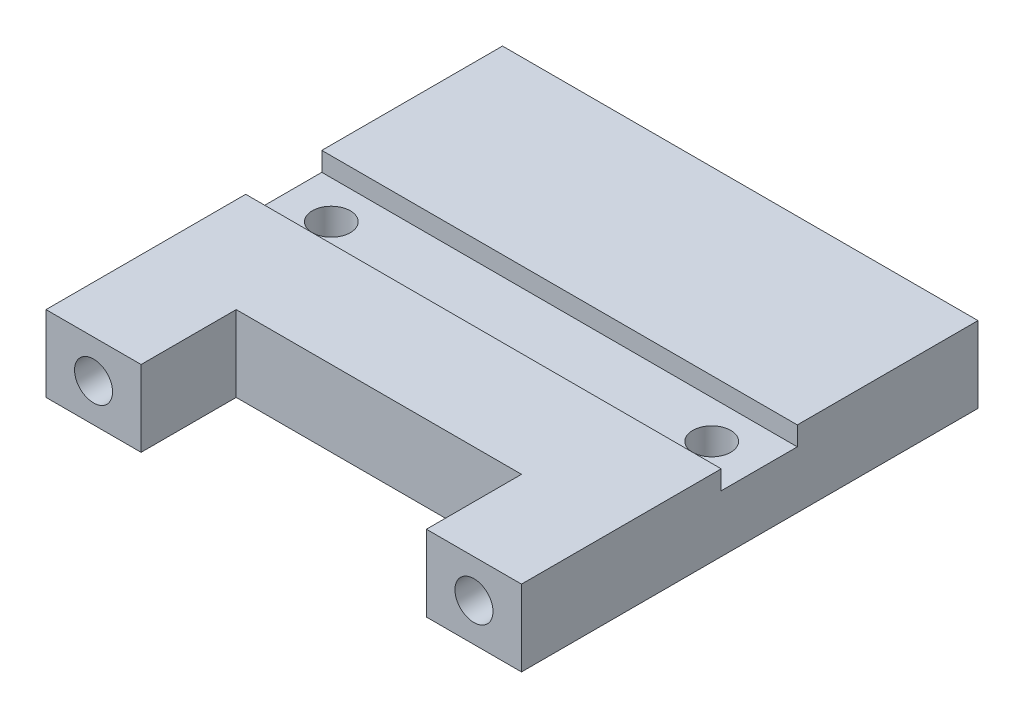
from build123d import *

# Parameters (mm, degrees)
BOSS_EXTRU_1_DEPTH      = 8
ESQUISSE2_R             = 2
ENL_V_MAT_EXTRU_1_DEPTH = 10
ENL_V_START             = -10
ESQUISSE3_R             = 2
ENL_V_MAT_EXTRU_2_DEPTH = 10
ESQUISSE4_R             = 2
ENL_V_MAT_EXTRU_3_DEPTH = 10
CHANFREIN1_SIZE         = 2.5
ESQUISSE5_W             = 50
ESQUISSE5_H             = 8
ENL_V_MAT_EXTRU_4_DEPTH = 2


with BuildPart() as part:
    # Esquisse1 → Boss.-Extru.1 (new body)
    with BuildSketch(Plane(origin=(0, 0, 0), x_dir=(1, 0, 0), z_dir=(0, 1, 0))):
        Polygon((-47.148145082, -1.958333333), (-47.148145082, 8.041666667), (-17.148145082, 8.041666667), (-17.148145082, -1.958333333), (-7.148145082, -1.958333333), (-7.148145082, 16.041666667), (-7.148145082, 46.041666667), (-57.148145082, 46.041666667), (-57.148145082, -1.958333333), align=None)
    extrude(amount=BOSS_EXTRU_1_DEPTH)

    # Esquisse2 → Enlèv. mat.-Extru.1 (cut)
    with BuildSketch(Plane.XY.offset(1.958333333)):
        with Locations((-52.148145082, 4)):
            Circle(ESQUISSE2_R)
        with Locations((-12.148145082, 4)):
            Circle(ESQUISSE2_R)
    extrude(amount=-ENL_V_MAT_EXTRU_1_DEPTH, mode=Mode.SUBTRACT)

    # Esquisse3 → Enlèv. mat.-Extru.2 (cut)
    with BuildSketch(Plane(origin=(0, 0, -46.041666667), x_dir=(-1, 0, 0), z_dir=(0, 0, -1)).offset(ENL_V_START)):
        with Locations((12.148145082, 4)):
            Circle(ESQUISSE3_R)
        with Locations((52.148145082, 4)):
            Circle(ESQUISSE3_R)
    extrude(amount=ENL_V_MAT_EXTRU_2_DEPTH, mode=Mode.SUBTRACT)

    # Esquisse4 → Enlèv. mat.-Extru.3 (cut)
    with BuildSketch(Plane(origin=(0, 8, 0), x_dir=(1, 0, 0), z_dir=(0, 1, 0))):
        with Locations((-52.148145082, 23.041666667)):
            Circle(ESQUISSE4_R)
        with Locations((-12.148145082, 23.041666667)):
            Circle(ESQUISSE4_R)
    extrude(amount=-ENL_V_MAT_EXTRU_3_DEPTH, mode=Mode.SUBTRACT)

    # Chanfrein1
    chanfrein1_edges = [part.edges().sort_by_distance(p)[0] for p in [
        (-54.148145082, 0, -23.041666667),
        (-14.148145082, 0, -23.041666667),
    ]]
    chamfer(chanfrein1_edges, length=CHANFREIN1_SIZE)

    # Esquisse5 → Enlèv. mat.-Extru.4 (cut)
    with BuildSketch(Plane(origin=(0, 8, 0), x_dir=(1, 0, 0), z_dir=(0, 1, 0))):
        with Locations((-32.148145082, 23.041666667)):
            Rectangle(ESQUISSE5_W, ESQUISSE5_H)
    extrude(amount=-ENL_V_MAT_EXTRU_4_DEPTH, mode=Mode.SUBTRACT)


solid = part.part
